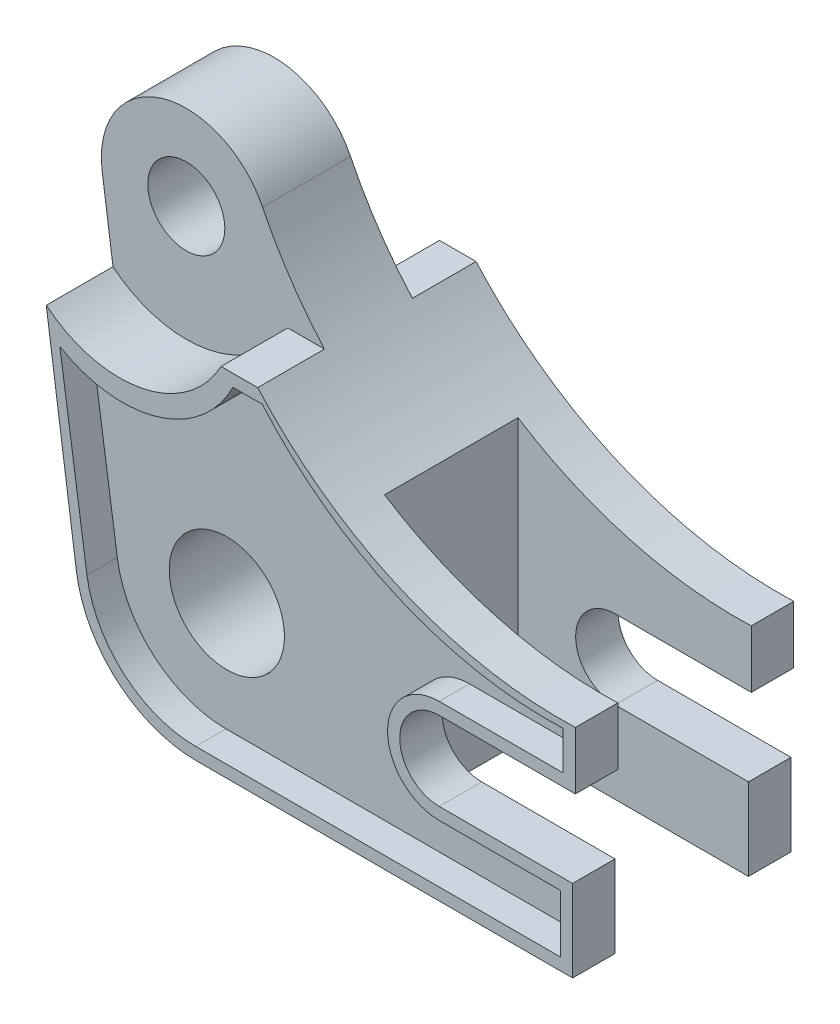
from build123d import *
from build123d.topology import SkipClean

# Parameters (mm, degrees)
SKETCH1_R                = 9.5
SKETCH1_R_2              = 6.35
BOSS_EXTRUDE2_DEPTH      = 26.5
CUT_EXTRUDE1_DEPTH       = 92.455760575
CUT_EXTRUDE1_DEPTH_BACK  = 6
CUT_EXTRUDE3_DEPTH       = 6
SKETCH4_W                = 12.5
SKETCH4_H                = 48
CUT_EXTRUDE6_DEPTH       = 38
SKETCH6_W                = 12.495626017
SKETCH6_H                = 9.497138144
CUT_EXTRUDE7_DEPTH       = 38
BOSS_EXTRUDE3_DEPTH      = 5
BOSS_EXTRUDE3_DEPTH_BACK = 31
SKETCH9_W                = 22
SKETCH9_H                = 48
CUT_EXTRUDE8_DEPTH       = 38
SKETCH10_W               = 22
SKETCH10_H               = 9.497138144
CUT_EXTRUDE9_DEPTH       = 38


with BuildPart() as part:
    # Sketch1 → Boss-Extrude2 (new body)
    with BuildSketch(Plane.XY):
        with BuildLine():
            Line((0, -20), (62, -20))
            Line((62, -20), (62, -6.5))
            Line((62, -6.5), (40, -6.5))
            ThreePointArc((40, -6.5), (33.5, 0), (40, 6.5))
            Line((40, 6.5), (62.453922306, 6.5))
            Line((62.453922306, 6.5), (62.453922306, 15.997138144))
            ThreePointArc((62.453922306, 15.997138144), (25.624113686, 25.483349596), (-0.108819518, 53.487619974))
            ThreePointArc((-0.108819518, 53.487619974), (-16.782102217, 60.716561891), (-26.547021707, 45.390038979))
            Line((-26.547021707, 45.390038979), (-19.806983567, -2.771895014))
            ThreePointArc((-19.806983567, -2.771895014), (-13.125587601, -15.09035951), (0, -20))
        make_face()
        Circle(SKETCH1_R, mode=Mode.SUBTRACT)
        with Locations((-12.68213321, 47.330365488)):
            Circle(SKETCH1_R_2, mode=Mode.SUBTRACT)
    extrude(amount=BOSS_EXTRUDE2_DEPTH)

    # Sketch2 → Cut-Extrude1 (cut, two sides: drawn at the far end of the back side and taken through both)
    with BuildSketch(Plane.XY.offset(26.5).offset(-CUT_EXTRUDE1_DEPTH_BACK)):
        with BuildLine():
            Line((-189.731827126, 168.638877607), (-24.7667399, 32.668773448))
            ThreePointArc((-24.7667399, 32.668773448), (-9.019379836, 28.686754311), (4.051067321, 38.330365488))
            Line((4.051067321, 38.330365488), (10.086589391, 38.330365488))
            Line((10.086589391, 38.330365488), (223.865328343, 38.330365488))
            Line((223.865328343, 38.330365488), (352.346297732, 446.126929251))
            Line((352.346297732, 446.126929251), (-61.250857737, 576.43544137))
            Line((-61.250857737, 576.43544137), (-189.731827126, 168.638877607))
        make_face()
    extrude(amount=CUT_EXTRUDE1_DEPTH + CUT_EXTRUDE1_DEPTH_BACK, mode=Mode.SUBTRACT)

    # Sketch3 → Cut-Extrude3 (cut)
    with BuildSketch(Plane(origin=(0, 0, 0), x_dir=(-1, 0, 0), z_dir=(0, 0, -1))):
        with BuildLine():
            Line((-4.051067321, 38.330365488), (-10.086589391, 38.330365488))
            ThreePointArc((-10.086589391, 38.330365488), (-4.46989561, 45.559898612), (0.108819518, 53.487619974))
            ThreePointArc((0.108819518, 53.487619974), (16.782102217, 60.716561891), (26.547021707, 45.390038979))
            Line((26.547021707, 45.390038979), (24.7667399, 32.668773448))
            ThreePointArc((24.7667399, 32.668773448), (9.019379836, 28.686754311), (-4.051067321, 38.330365488))
        make_face()
    extrude(amount=-CUT_EXTRUDE3_DEPTH, mode=Mode.SUBTRACT)

    # Sketch4 → Cut-Extrude6 (cut)
    with BuildSketch(Plane(origin=(62, 0, 0), x_dir=(0, 0, -1), z_dir=(1, 0, 0))):
        with Locations((-13.25, 4)):
            Rectangle(SKETCH4_W, SKETCH4_H)
    extrude(amount=-CUT_EXTRUDE6_DEPTH, mode=Mode.SUBTRACT)

    # Sketch6 → Cut-Extrude7 (cut)
    with BuildSketch(Plane(origin=(62.453922306, 0, 0), x_dir=(0, 0, -1), z_dir=(1, 0, 0))):
        with Locations((-13.252186992, 11.248569072)):
            Rectangle(SKETCH6_W, SKETCH6_H)
    extrude(amount=-CUT_EXTRUDE7_DEPTH, mode=Mode.SUBTRACT)

    # Sketch7 → Boss-Extrude3 (add, two sides: drawn at the far end of the back side and taken through both)
    with SkipClean():  # the faces are left unmerged after this step: merging them gives an invalid solid
        with BuildSketch(Plane.XY.offset(26.5).offset(-BOSS_EXTRUDE3_DEPTH_BACK)):
            with BuildLine():
                Line((62.453922306, 15.997138144), (62.453922306, 6.5))
                Line((62.453922306, 6.5), (40, 6.5))
                ThreePointArc((40, 6.5), (33.5, 0), (40, -6.5))
                Line((40, -6.5), (62, -6.5))
                Line((62, -6.5), (62, -20))
                Line((62, -20), (0, -20))
                ThreePointArc((0, -20), (-13.125587601, -15.09035951), (-19.806983567, -2.771895014))
                Line((-19.806983567, -2.771895014), (-24.7667399, 32.668773448))
                ThreePointArc((-24.7667399, 32.668773448), (-9.019379836, 28.686754311), (4.051067321, 38.330365488))
                Line((4.051067321, 38.330365488), (10.086589391, 38.330365488))
                ThreePointArc((10.086589391, 38.330365488), (33.780199402, 21.325024932), (62.453922306, 15.997138144))
            make_face()
            with BuildLine():
                Line((60, -18), (-0.123512642, -18))
                ThreePointArc((-0.123512642, -18), (-11.970509899, -13.591955884), (-18.054730933, -2.512043821))
                Line((-18.054730933, -2.512043821), (-22.524166791, 27.891263931))
                ThreePointArc((-22.524166791, 27.891263931), (-6.423107965, 25.901981466), (6.004689376, 36.330365488))
                Line((6.004689376, 36.330365488), (10.840773799, 36.330365488))
                ThreePointArc((10.840773799, 36.330365488), (33.205696286, 19.95378499), (60.453922306, 14.862977059))
                Line((60.453922306, 14.862977059), (60.453922306, 8.5))
                Line((60.453922306, 8.5), (40, 8.5))
                ThreePointArc((40, 8.5), (31.5, 0), (40, -8.5))
                Line((40, -8.5), (60, -8.5))
                Line((60, -8.5), (60, -18))
            make_face(mode=Mode.SUBTRACT)
        extrude(amount=BOSS_EXTRUDE3_DEPTH + BOSS_EXTRUDE3_DEPTH_BACK)
    add(part.part.scale(1), mode=Mode.REPLACE)  # the faces are merged on a copy

    # Sketch9 → Cut-Extrude8 (cut)
    with BuildSketch(Plane(origin=(62, 0, 0), x_dir=(0, 0, -1), z_dir=(1, 0, 0))):
        with Locations((-13.5, 4)):
            Rectangle(SKETCH9_W, SKETCH9_H)
    extrude(amount=-CUT_EXTRUDE8_DEPTH, mode=Mode.SUBTRACT)

    # Sketch10 → Cut-Extrude9 (cut)
    with BuildSketch(Plane(origin=(62.453922306, 0, 0), x_dir=(0, 0, -1), z_dir=(1, 0, 0))):
        with Locations((-13.5, 11.248569072)):
            Rectangle(SKETCH10_W, SKETCH10_H)
    extrude(amount=-CUT_EXTRUDE9_DEPTH, mode=Mode.SUBTRACT)


solid = part.part
